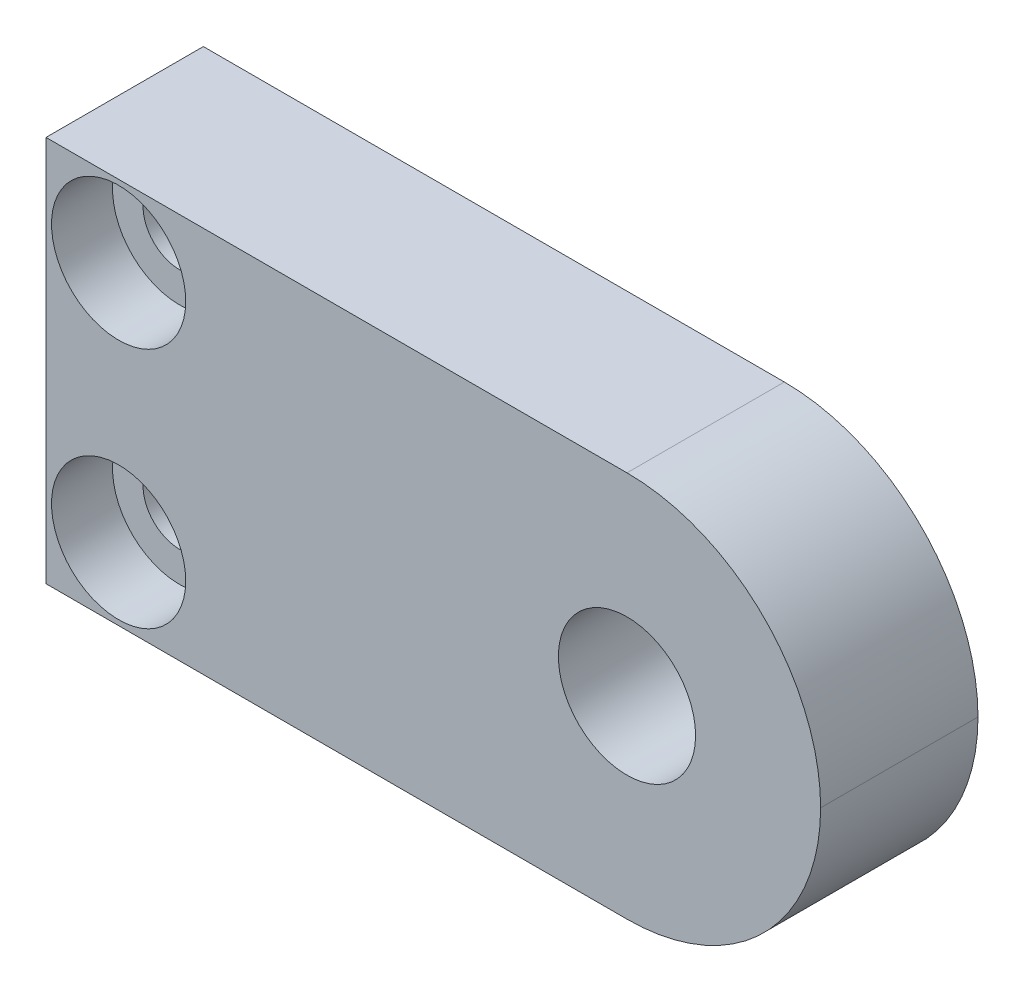
from build123d import *

# Parameters (mm, degrees)
SKETCH1_W                      = 25.4
SKETCH1_H                      = 12.6746
BOSS_EXTRUDE1_DEPTH            = 5.159375
SKETCH2_R                      = 2.24917
CUT_EXTRUDE1_DEPTH             = 27.682213583
FILLET1_R                      = 6.35
CBORE_FOR_M2_SHCS1_D           = 2.4
CBORE_FOR_M2_SHCS1_CBORE_D     = 4.4
CBORE_FOR_M2_SHCS1_CBORE_DEPTH = 2


with BuildPart() as part:
    # Sketch1 → Boss-Extrude1 (new body)
    with BuildSketch(Plane.XY):
        with Locations((12.7, 0)):
            Rectangle(SKETCH1_W, SKETCH1_H)
    extrude(amount=BOSS_EXTRUDE1_DEPTH)

    # Sketch2 → Cut-Extrude1 (cut, through all)
    with BuildSketch(Plane.XY.offset(5.159375)):
        with Locations((19.05, 0)):
            Circle(SKETCH2_R)
    extrude(amount=-CUT_EXTRUDE1_DEPTH, mode=Mode.SUBTRACT)

    # Fillet1
    # the kernel refuses this fillet: 6.35 mm, written as the material it takes off along each edge
    with BuildSketch(Plane(origin=(25.4, -6.3373, -15.875), x_dir=(0, 1, 0), z_dir=(0, 0, 1)), Plane(origin=(25.4, 6.3373, -15.875), x_dir=(-1, 0, 0), z_dir=(0, 0, 1))) as fillet1_piece_1:
        with BuildLine():
            CenterArc((FILLET1_R, FILLET1_R), FILLET1_R, 180, 90)
            Line((0, FILLET1_R), (0, 0))
            Line((0, 0), (FILLET1_R, 0))
        make_face()
    extrude(amount=36.909375, mode=Mode.SUBTRACT)

    # CBORE for M2 SHCS1 (through all)
    with Locations(Plane.XY.offset(5.159375)):
        with Locations((2.38125, 3.96875), (2.38125, -3.96875)):
            CounterBoreHole(CBORE_FOR_M2_SHCS1_D / 2, CBORE_FOR_M2_SHCS1_CBORE_D / 2, CBORE_FOR_M2_SHCS1_CBORE_DEPTH)


solid = part.part
